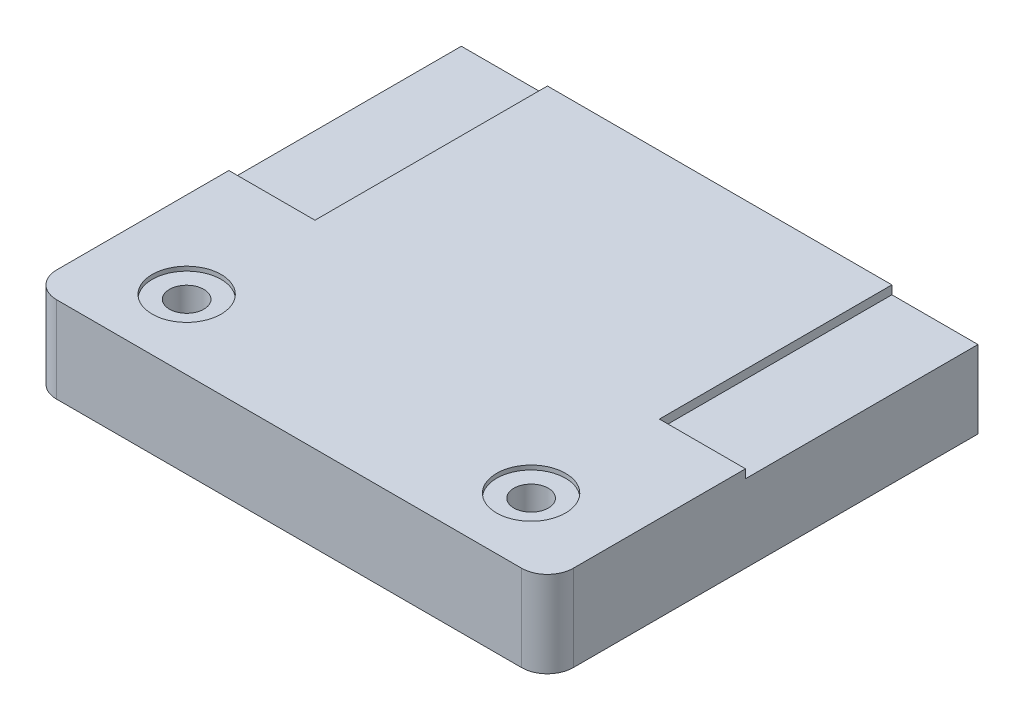
from build123d import *

# Parameters (mm, degrees)
SKETCH_1_W          = 60
SKETCH_1_H          = 50
EXTRUDE_1_DEPTH     = 10
FILLET_1_R          = 3
SKETCH_2_R          = 4
CUT_EXTRUDE_1_DEPTH = 0.5
SKETCH_4_W          = 10
SKETCH_4_H          = 27
CUT_EXTRUDE_2_DEPTH = 1
SKETCH_5_R          = 2
CUT_EXTRUDE_3_DEPTH = 41.311288741


with BuildPart() as part:
    # 草图1 → 凸台-拉伸1 (new body)
    with BuildSketch(Plane(origin=(0, 0, 0), x_dir=(1, 0, 0), z_dir=(0, 1, 0))):
        Rectangle(SKETCH_1_W, SKETCH_1_H)
    extrude(amount=EXTRUDE_1_DEPTH)

    # 圆角1
    fillet_1_edges = [part.edges().sort_by_distance(p)[0] for p in [
        (-30, 5, 25),
        (30, 5, 25),
    ]]
    fillet(fillet_1_edges, radius=FILLET_1_R)

    # 草图2 → 切除-拉伸1 (cut)
    with BuildSketch(Plane(origin=(0, 10, 0), x_dir=(1, 0, 0), z_dir=(0, 1, 0))):
        with Locations((-20, -16.9)):
            Circle(SKETCH_2_R)
        with Locations((20, -16.9)):
            Circle(SKETCH_2_R)
    extrude(amount=-CUT_EXTRUDE_1_DEPTH, mode=Mode.SUBTRACT)

    # 草图4 → 切除-拉伸2 (cut)
    with BuildSketch(Plane(origin=(0, 10, 0), x_dir=(1, 0, 0), z_dir=(0, 1, 0))):
        with Locations((-25, 11.5)):
            Rectangle(SKETCH_4_W, SKETCH_4_H)
        with Locations((25, 11.5)):
            Rectangle(SKETCH_4_W, SKETCH_4_H)
    extrude(amount=-CUT_EXTRUDE_2_DEPTH, mode=Mode.SUBTRACT)

    # 草图5 → 切除-拉伸3 (cut, through all)
    with BuildSketch(Plane(origin=(0, 10, 0), x_dir=(1, 0, 0), z_dir=(0, 1, 0))):
        with Locations((-20, -16.9)):
            Circle(SKETCH_5_R)
        with Locations((20, -16.9)):
            Circle(SKETCH_5_R)
    extrude(amount=-CUT_EXTRUDE_3_DEPTH, mode=Mode.SUBTRACT)


solid = part.part
